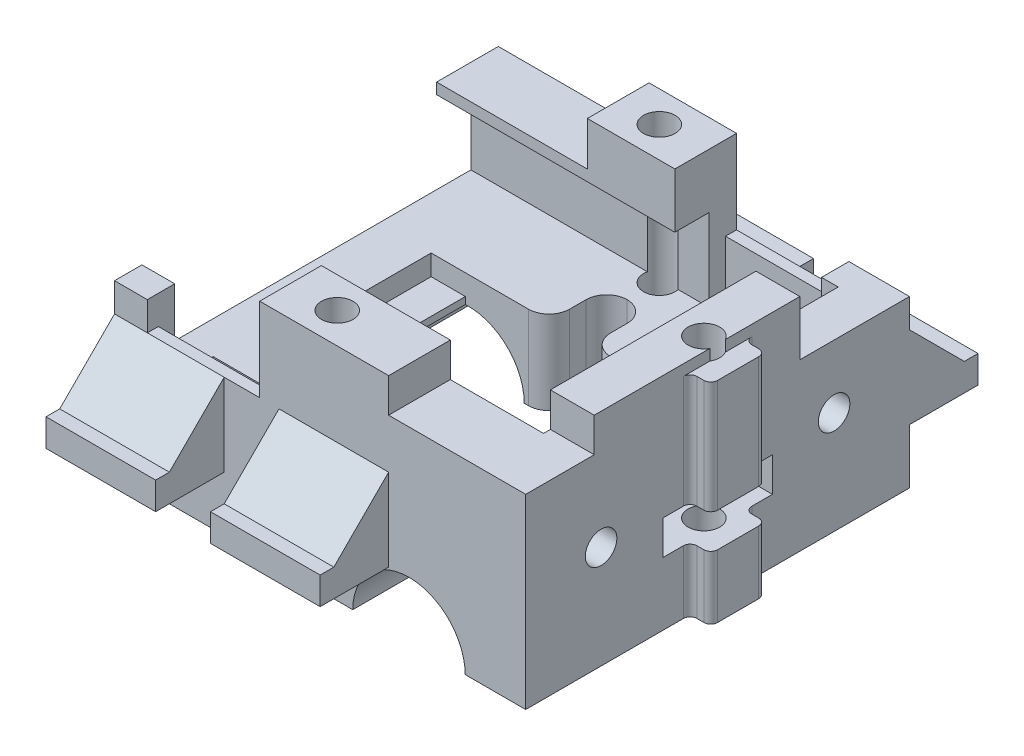
from build123d import *

# Parameters (mm, degrees)
SKETCH1_W           = 28
SKETCH1_H           = 16.1
BOSS_EXTRUDE1_DEPTH = 30
SKETCH2_W           = 10
SKETCH2_H           = 2.5
CUT_EXTRUDE1_DEPTH  = 5
SKETCH3_W           = 10
SKETCH3_H           = 4
CUT_EXTRUDE2_DEPTH  = 8
SKETCH4_W           = 10
SKETCH4_H           = 3.2
CUT_EXTRUDE3_DEPTH  = 8
SKETCH5_W           = 11
SKETCH5_H           = 4
CUT_EXTRUDE4_DEPTH  = 8
SKETCH6_W           = 20
SKETCH6_H           = 2
BOSS_EXTRUDE2_DEPTH = 5
CHAMFER1_SIZE       = 4
SKETCH7_W           = 20
SKETCH7_H           = 2
BOSS_EXTRUDE3_DEPTH = 5
CHAMFER2_SIZE       = 4
SKETCH9_W           = 25.8
SKETCH9_H           = 19
CUT_EXTRUDE6_DEPTH  = 10
SKETCH13_R          = 4.1
CUT_EXTRUDE10_DEPTH = 27.2
SKETCH14_R          = 4.1
CUT_EXTRUDE11_DEPTH = 27.2
SKETCH15_W          = 8.2
SKETCH15_H          = 4
CUT_EXTRUDE12_DEPTH = 27.2
SKETCH16_W          = 0.59230819
SKETCH16_H          = 0.8
SKETCH16_W_2        = 1.617695922
CUT_EXTRUDE13_DEPTH = 4
SKETCH17_W          = 1.5
SKETCH17_H          = 4
BOSS_EXTRUDE4_DEPTH = 16.1
FILLET1_R           = 0.5
SKETCH18_R          = 3.5
CUT_EXTRUDE14_DEPTH = 6.1
SKETCH19_W          = 8
SKETCH19_H          = 1
CUT_EXTRUDE15_DEPTH = 10
SKETCH20_W          = 20.5
SKETCH20_H          = 10.6
CUT_EXTRUDE16_DEPTH = 1.5
SKETCH21_W          = 5.7
SKETCH21_H          = 8
CUT_EXTRUDE17_DEPTH = 1.5
SKETCH22_W          = 8
SKETCH22_H          = 2.5
CUT_EXTRUDE18_DEPTH = 1.5
SKETCH23_R          = 1.15
CUT_EXTRUDE19_DEPTH = 75.620049118
SKETCH24_W          = 8.2
SKETCH24_H          = 0.8
CUT_EXTRUDE20_DEPTH = 2.1
CUT_EXTRUDE21_REACH = 75.421
SKETCH25_W          = 7.929527271
SKETCH25_H          = 0.8
CUT_EXTRUDE22_START = -5
SKETCH26_W          = 4
SKETCH26_H          = 6
CUT_EXTRUDE22_DEPTH = 5
CUT_EXTRUDE23_START = -5
SKETCH27_W          = 4
SKETCH27_H          = 6
CUT_EXTRUDE23_DEPTH = 5
SKETCH28_R          = 1.15
CUT_EXTRUDE24_DEPTH = 3.2
CUT_EXTRUDE25_REACH = 75.764
SKETCH29_W          = 15.5
SKETCH29_H          = 10.6
CUT_EXTRUDE27_REACH = 75.421
SKETCH30_W          = 24
SKETCH30_H          = 6
CUT_EXTRUDE29_DEPTH = 1
SKETCH33_W          = 3
SKETCH33_H          = 4.2
CUT_EXTRUDE30_DEPTH = 6.1
FILLET2_START       = -9.040821865
FILLET2_DEPTH       = 6.1
FILLET2_2_DEPTH     = 6.1


with BuildPart() as part:
    # Sketch1 → Boss-Extrude1 (new body)
    with BuildSketch(Plane(origin=(0, 0, 0), x_dir=(0, 0, -1), z_dir=(1, 0, 0))):
        with Locations((-46.701535197, -0.990821865)):
            Rectangle(SKETCH1_W, SKETCH1_H)
    extrude(amount=BOSS_EXTRUDE1_DEPTH)

    # Sketch2 → Cut-Extrude1 (cut)
    with BuildSketch(Plane.XY.offset(60.701535197)):
        with Locations((25, 5.809178135)):
            Rectangle(SKETCH2_W, SKETCH2_H)
    extrude(amount=-CUT_EXTRUDE1_DEPTH, mode=Mode.SUBTRACT)

    # Sketch3 → Cut-Extrude2 (cut)
    with BuildSketch(Plane.XY.offset(60.701535197)):
        with Locations((5, 5.059178135)):
            Rectangle(SKETCH3_W, SKETCH3_H)
    extrude(amount=-CUT_EXTRUDE2_DEPTH, mode=Mode.SUBTRACT)

    # Sketch4 → Cut-Extrude3 (cut)
    with BuildSketch(Plane(origin=(0, 0, 32.701535197), x_dir=(-1, 0, 0), z_dir=(0, 0, -1))):
        with Locations((-6, 5.459178135)):
            Rectangle(SKETCH4_W, SKETCH4_H)
    extrude(amount=-CUT_EXTRUDE3_DEPTH, mode=Mode.SUBTRACT)

    # Sketch5 → Cut-Extrude4 (cut)
    with BuildSketch(Plane(origin=(0, 0, 32.701535197), x_dir=(-1, 0, 0), z_dir=(0, 0, -1))):
        with Locations((-24.5, 5.059178135)):
            Rectangle(SKETCH5_W, SKETCH5_H)
    extrude(amount=-CUT_EXTRUDE4_DEPTH, mode=Mode.SUBTRACT)

    # Sketch6 → Boss-Extrude2 (add)
    with BuildSketch(Plane(origin=(0, 0, 32.701535197), x_dir=(-1, 0, 0), z_dir=(0, 0, -1))):
        with Locations((-20, -4.040821865)):
            Rectangle(SKETCH6_W, SKETCH6_H)
    extrude(amount=BOSS_EXTRUDE2_DEPTH)

    # Chamfer1
    chamfer1_edges = [part.edges().sort_by_distance(p)[0] for p in [
        (20, -3.040821865, 32.701535197),
    ]]
    chamfer(chamfer1_edges, length=CHAMFER1_SIZE)

    # Sketch7 → Boss-Extrude3 (add)
    with BuildSketch(Plane.XY.offset(60.701535197)):
        with Locations((10, -4.040821865)):
            Rectangle(SKETCH7_W, SKETCH7_H)
    extrude(amount=BOSS_EXTRUDE3_DEPTH)

    # Chamfer2
    chamfer2_edges = [part.edges().sort_by_distance(p)[0] for p in [
        (10, -3.040821865, 60.701535197),
    ]]
    chamfer(chamfer2_edges, length=CHAMFER2_SIZE)

    # Sketch9 → Cut-Extrude6 (cut)
    with BuildSketch(Plane(origin=(0, 7.059178135, 0), x_dir=(1, 0, 0), z_dir=(0, 1, 0))):
        with Locations((13.9, -46.701535197)):
            Rectangle(SKETCH9_W, SKETCH9_H)
    extrude(amount=-CUT_EXTRUDE6_DEPTH, mode=Mode.SUBTRACT)

    # Sketch13 → Cut-Extrude10 (cut)
    with BuildSketch(Plane.XY.offset(60.701535197)):
        with Locations((21.482304078, -9.040821865)):
            Circle(SKETCH13_R)
    extrude(amount=-CUT_EXTRUDE10_DEPTH, mode=Mode.SUBTRACT)

    # Sketch14 → Cut-Extrude11 (cut)
    with BuildSketch(Plane(origin=(0, 0, 32.701535197), x_dir=(-1, 0, 0), z_dir=(0, 0, -1))):
        with Locations((-6.49230819, -9.040821865)):
            Circle(SKETCH14_R)
    extrude(amount=-CUT_EXTRUDE11_DEPTH, mode=Mode.SUBTRACT)

    # Sketch15 → Cut-Extrude12 (cut)
    with BuildSketch(Plane.XZ.offset(9.040821865)):
        with Locations((6.49230819, 57.901535197)):
            Rectangle(SKETCH15_W, SKETCH15_H)
        with Locations((21.482304078, 35.501535197)):
            Rectangle(SKETCH15_W, SKETCH15_H)
    extrude(amount=-CUT_EXTRUDE12_DEPTH, mode=Mode.SUBTRACT)

    # Sketch16 → Cut-Extrude13 (cut)
    with BuildSketch(Plane(origin=(0, 7.059178135, 0), x_dir=(1, 0, 0), z_dir=(0, 1, 0))):
        with Locations((10.296154095, -60.301535197)):
            Rectangle(SKETCH16_W, SKETCH16_H)
        with Locations((18.191152039, -33.101535197)):
            Rectangle(SKETCH16_W_2, SKETCH16_H)
    extrude(amount=-CUT_EXTRUDE13_DEPTH, mode=Mode.SUBTRACT)

    # Sketch17 → Boss-Extrude4 (add)
    with BuildSketch(Plane.XZ.offset(9.040821865)):
        with Locations((30.75, 46.701535197)):
            Rectangle(SKETCH17_W, SKETCH17_H)
    extrude(amount=-BOSS_EXTRUDE4_DEPTH)

    # Fillet1
    fillet1_edges = [part.edges().sort_by_distance(p)[0] for p in [
        (30, -0.990821865, 44.701535197),
        (30, -0.990821865, 48.701535197),
        (31.5, -0.990821865, 48.701535197),
        (31.5, -0.990821865, 44.701535197),
    ]]
    fillet(fillet1_edges, radius=FILLET1_R)

    # Sketch18 → Cut-Extrude14 (cut)
    with BuildSketch(Plane.XZ.offset(9.040821865)):
        with Locations(Location((13.985, 46.701535197, 0), (0, 0, 194.224464848))):
            Circle(SKETCH18_R)
    extrude(amount=-CUT_EXTRUDE14_DEPTH, mode=Mode.SUBTRACT)

    # Sketch19 → Cut-Extrude15 (cut)
    with BuildSketch(Plane(origin=(31.5, 0, 0), x_dir=(0, 0, -1), z_dir=(1, 0, 0))):
        with Locations((-46.701535197, -2.440821865)):
            Rectangle(SKETCH19_W, SKETCH19_H)
    extrude(amount=-CUT_EXTRUDE15_DEPTH, mode=Mode.SUBTRACT)

    # Sketch20 → Cut-Extrude16 (cut)
    with BuildSketch(Plane(origin=(0, -2.940821865, 0), x_dir=(1, 0, 0), z_dir=(0, 1, 0))):
        with Locations((14.05, -46.701535197)):
            Rectangle(SKETCH20_W, SKETCH20_H)
    extrude(amount=-CUT_EXTRUDE16_DEPTH, mode=Mode.SUBTRACT)

    # Sketch21 → Cut-Extrude17 (cut)
    with BuildSketch(Plane(origin=(0, -2.940821865, 0), x_dir=(1, 0, 0), z_dir=(0, 1, 0))):
        with Locations((27.15, -46.701535197)):
            Rectangle(SKETCH21_W, SKETCH21_H)
    extrude(amount=-CUT_EXTRUDE17_DEPTH, mode=Mode.SUBTRACT)

    # Sketch22 → Cut-Extrude18 (cut)
    with BuildSketch(Plane(origin=(31.5, 0, 0), x_dir=(0, 0, -1), z_dir=(1, 0, 0))):
        with Locations((-46.701535197, -3.190821865)):
            Rectangle(SKETCH22_W, SKETCH22_H)
    extrude(amount=-CUT_EXTRUDE18_DEPTH, mode=Mode.SUBTRACT)

    # Sketch23 → Cut-Extrude19 (cut, through all)
    with BuildSketch(Plane(origin=(0, 7.059178135, 0), x_dir=(1, 0, 0), z_dir=(0, 1, 0))):
        with Locations(Location((29, -46.701535197, 0), (0, 0, 270))):
            Circle(SKETCH23_R)
        with Locations(Location((14, -34.951535197, 0), (0, 0, 270))):
            Circle(SKETCH23_R)
        with Locations(Location((14, -58.451535197, 0), (0, 0, 270))):
            Circle(SKETCH23_R)
    extrude(amount=-CUT_EXTRUDE19_DEPTH, mode=Mode.SUBTRACT)

    # Sketch24 → Cut-Extrude20 (cut)
    with BuildSketch(Plane(origin=(0, 3.059178135, 0), x_dir=(1, 0, 0), z_dir=(0, 1, 0))):
        with Locations((21.482304078, -33.101535197)):
            Rectangle(SKETCH24_W, SKETCH24_H)
        with Locations((6.49230819, -60.301535197)):
            Rectangle(SKETCH24_W, SKETCH24_H)
    extrude(amount=-CUT_EXTRUDE20_DEPTH, mode=Mode.SUBTRACT)

    # Cut-Extrude21: up to this face of the body (flat: up to its plane)
    cut_extrude21_end = Plane(part.part.faces().sort_by_distance((30, -1.445232759, 54.822020691))[0])
    # Sketch25 → Cut-Extrude21 (cut, up to the picked face)
    with BuildSketch(Plane(origin=(31.5, 0, 0), x_dir=(0, 0, -1), z_dir=(1, 0, 0)), mode=Mode.PRIVATE) as cut_extrude21_sk1:
        with Locations((-46.553400254, 6.659178135)):
            Rectangle(SKETCH25_W, SKETCH25_H)
    cut_extrude21_tool1 = split(extrude(cut_extrude21_sk1.sketch, amount=-CUT_EXTRUDE21_REACH, mode=Mode.PRIVATE), bisect_by=cut_extrude21_end, keep=Keep.BOTH, mode=Mode.PRIVATE)
    add(cut_extrude21_tool1.solids().sort_by(Axis((31.5, 6.659178, 46.5534), (-1, 0, 0)))[0], mode=Mode.SUBTRACT)

    # Sketch26 → Cut-Extrude22 (cut)
    with BuildSketch(Plane.XY.offset(65.701535197).offset(CUT_EXTRUDE22_START)):
        with Locations((10, -2.040821865)):
            Rectangle(SKETCH26_W, SKETCH26_H)
    extrude(amount=CUT_EXTRUDE22_DEPTH, mode=Mode.SUBTRACT)

    # Sketch27 → Cut-Extrude23 (cut)
    with BuildSketch(Plane(origin=(0, 0, 27.701535197), x_dir=(-1, 0, 0), z_dir=(0, 0, -1)).offset(CUT_EXTRUDE23_START)):
        with Locations((-20, -2.040821865)):
            Rectangle(SKETCH27_W, SKETCH27_H)
    extrude(amount=CUT_EXTRUDE23_DEPTH, mode=Mode.SUBTRACT)

    # Sketch28 → Cut-Extrude24 (cut)
    with BuildSketch(Plane(origin=(30, 0, 0), x_dir=(0, 0, -1), z_dir=(1, 0, 0))):
        with Locations((-55.201535197, -1.540821865)):
            Circle(SKETCH28_R)
        with Locations((-38.201535197, -1.540821865)):
            Circle(SKETCH28_R)
    extrude(amount=-CUT_EXTRUDE24_DEPTH, mode=Mode.SUBTRACT)

    # Cut-Extrude25: up to this face of the body (flat: up to its plane)
    cut_extrude25_end = Plane(part.part.faces().sort_by_distance((10.921875254, -9.040821865, 51.731547487))[0])
    # Sketch29 → Cut-Extrude25 (cut, up to the picked face)
    with BuildSketch(Plane(origin=(0, -4.440821865, 0), x_dir=(1, 0, 0), z_dir=(0, 1, 0)), mode=Mode.PRIVATE) as cut_extrude25_sk1:
        with Locations((14.05, -46.701535197)):
            Rectangle(SKETCH29_W, SKETCH29_H)
    cut_extrude25_tool1 = split(extrude(cut_extrude25_sk1.sketch, amount=-CUT_EXTRUDE25_REACH, mode=Mode.PRIVATE), bisect_by=cut_extrude25_end, keep=Keep.BOTH, mode=Mode.PRIVATE)
    add(cut_extrude25_tool1.solids().sort_by(Axis((14.05, -4.440822, 46.701535), (0, -1, 0)))[0], mode=Mode.SUBTRACT)

    # Cut-Extrude27: up to this face of the body (flat: up to its plane)
    cut_extrude27_end = Plane(part.part.faces().sort_by_distance((26.8, 2.175126911, 47.312469979))[0])
    # Sketch30 → Cut-Extrude27 (cut, up to the picked face)
    with BuildSketch(Plane.ZY, mode=Mode.PRIVATE) as cut_extrude27_sk1:
        with Locations((46.701535197, 0.059178135)):
            Rectangle(SKETCH30_W, SKETCH30_H)
    cut_extrude27_tool1 = split(extrude(cut_extrude27_sk1.sketch, amount=-CUT_EXTRUDE27_REACH, mode=Mode.PRIVATE), bisect_by=cut_extrude27_end, keep=Keep.BOTH, mode=Mode.PRIVATE)
    add(cut_extrude27_tool1.solids().sort_by(Axis((0, 0.059178, 46.701535), (1, 0, 0)))[0], mode=Mode.SUBTRACT)

    # Sketch32 → Cut-Extrude29 (cut)
    with BuildSketch(Plane(origin=(1, 0, 0), x_dir=(0, 0, -1), z_dir=(1, 0, 0))):
        Polygon((-32.701535197, 3.859178135), (-37.201535197, 3.859178135), (-37.201535197, 3.059178135), (-52.701535197, 3.059178135), (-52.701535197, 7.059178135), (-32.701535197, 7.059178135), align=None)
    extrude(amount=-CUT_EXTRUDE29_DEPTH, mode=Mode.SUBTRACT)

    # Sketch33 → Cut-Extrude30 (cut)
    with BuildSketch(Plane(origin=(0, -2.940821865, 0), x_dir=(1, 0, 0), z_dir=(0, 1, 0))):
        with Locations((13.9, -39.301535197)):
            Rectangle(SKETCH33_W, SKETCH33_H)
        with Locations((13.9, -54.101535197)):
            Rectangle(SKETCH33_W, SKETCH33_H)
    extrude(amount=-CUT_EXTRUDE30_DEPTH, mode=Mode.SUBTRACT)

    # Fillet2: read off the stored shape, not the designer's step
    # Fillet2 outline → Fillet2 (cut)
    with BuildSketch(Plane(origin=(0, 0, 0), x_dir=(1, 0, 0), z_dir=(0, 1, 0)).offset(FILLET2_START)):
        with BuildLine():
            ThreePointArc((16.9, -41.401535197), (15.839339828, -40.962195368), (15.4, -39.901535197))
            Line((15.4, -39.901535197), (15.4, -41.401535197))
            Line((15.4, -41.401535197), (16.9, -41.401535197))
        make_face()
        with BuildLine():
            Line((12.4, -41.401535197), (12.4, -39.901535197))
            ThreePointArc((12.4, -39.901535197), (11.960660172, -40.962195369), (10.9, -41.401535197))
            Line((10.9, -41.401535197), (12.4, -41.401535197))
        make_face()
        with BuildLine():
            ThreePointArc((10.9, -52.001535197), (11.960660172, -52.440875025), (12.4, -53.501535197))
            Line((12.4, -53.501535197), (12.4, -52.001535197))
            Line((12.4, -52.001535197), (10.9, -52.001535197))
        make_face()
        with BuildLine():
            Line((15.4, -52.001535197), (15.4, -53.501535197))
            ThreePointArc((15.4, -53.501535197), (15.839339828, -52.440875025), (16.9, -52.001535197))
            Line((16.9, -52.001535197), (15.4, -52.001535197))
        make_face()
    extrude(amount=FILLET2_DEPTH, mode=Mode.SUBTRACT)

    # Fillet2 2 outline → Fillet2 2 (add)
    with BuildSketch(Plane(origin=(0, 0, 0), x_dir=(1, 0, 0), z_dir=(0, 1, 0)).offset(FILLET2_START)):
        with BuildLine():
            ThreePointArc((12.4, -38.701535197), (12.839339828, -37.640875025), (13.9, -37.201535197))
            Line((13.9, -37.201535197), (12.4, -37.201535197))
            Line((12.4, -37.201535197), (12.4, -38.701535197))
        make_face()
        with BuildLine():
            ThreePointArc((13.9, -37.201535197), (14.960660172, -37.640875025), (15.4, -38.701535197))
            Line((15.4, -38.701535197), (15.4, -37.201535197))
            Line((15.4, -37.201535197), (13.9, -37.201535197))
        make_face()
        with BuildLine():
            ThreePointArc((15.4, -54.701535197), (14.960660172, -55.762195369), (13.9, -56.201535197))
            Line((13.9, -56.201535197), (15.4, -56.201535197))
            Line((15.4, -56.201535197), (15.4, -54.701535197))
        make_face()
        with BuildLine():
            ThreePointArc((13.9, -56.201535197), (12.839339828, -55.762195369), (12.4, -54.701535197))
            Line((12.4, -54.701535197), (12.4, -56.201535197))
            Line((12.4, -56.201535197), (13.9, -56.201535197))
        make_face()
    extrude(amount=FILLET2_2_DEPTH)


solid = part.part
